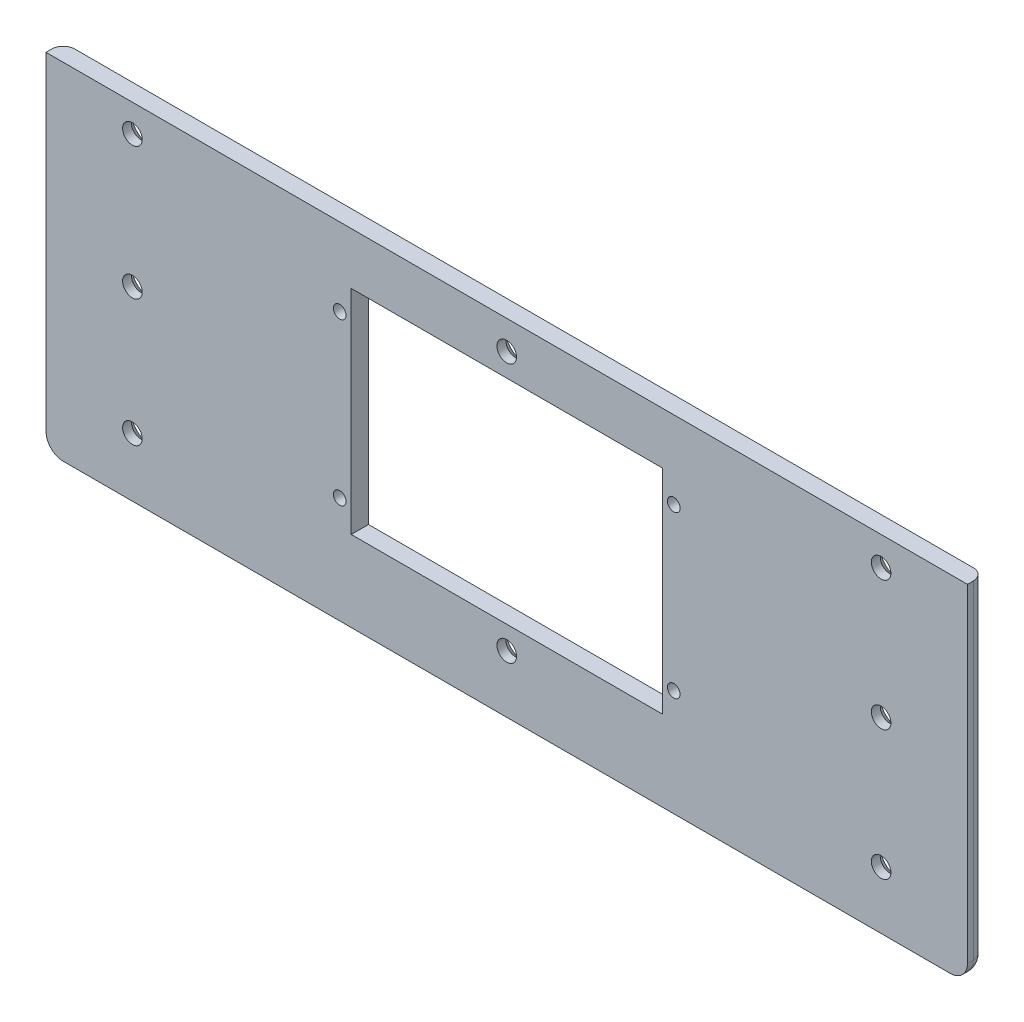
from build123d import *

# Parameters (mm, degrees)
SKETCH1_W                                      = 160
SKETCH1_H                                      = 60
BOSS_EXTRUDE1_DEPTH                            = 3
SKETCH2_R                                      = 1.1
SKETCH2_W                                      = 54
SKETCH2_H                                      = 37
CUT_EXTRUDE1_DEPTH                             = 171.906407136
FILLET1_R                                      = 2
FILLET2_R                                      = 3
CSK_FOR_M3_FLAT_HEAD_MACHINE_SCREW1_AT_2_COUNT = 2
CSK_FOR_M3_FLAT_HEAD_MACHINE_SCREW1_AT_2_PITCH = 22.5
CSK_FOR_M3_FLAT_HEAD_MACHINE_SCREW1_AT_3_COUNT = 2
CSK_FOR_M3_FLAT_HEAD_MACHINE_SCREW1_AT_3_PITCH = 45
CSK_FOR_M3_FLAT_HEAD_MACHINE_SCREW1_AT_4_COUNT = 2
CSK_FOR_M3_FLAT_HEAD_MACHINE_SCREW1_AT_4_PITCH = 79.056941504
CSK_FOR_M3_FLAT_HEAD_MACHINE_SCREW1_AT_5_COUNT = 2
CSK_FOR_M3_FLAT_HEAD_MACHINE_SCREW1_AT_5_PITCH = 65
CSK_FOR_M3_FLAT_HEAD_MACHINE_SCREW1_AT_6_COUNT = 2
CSK_FOR_M3_FLAT_HEAD_MACHINE_SCREW1_AT_6_PITCH = 130.000201211
CSK_FOR_M3_FLAT_HEAD_MACHINE_SCREW1_AT_7_COUNT = 2
CSK_FOR_M3_FLAT_HEAD_MACHINE_SCREW1_AT_7_PITCH = 131.97194743
CSK_FOR_M3_FLAT_HEAD_MACHINE_SCREW1_AT_8_COUNT = 2
CSK_FOR_M3_FLAT_HEAD_MACHINE_SCREW1_AT_8_PITCH = 137.493516675


with BuildPart() as part:
    # Sketch1 → Boss-Extrude1 (new body)
    with BuildSketch(Plane.XY):
        with Locations((80, 30)):
            Rectangle(SKETCH1_W, SKETCH1_H)
    extrude(amount=BOSS_EXTRUDE1_DEPTH)

    # Sketch2 → Cut-Extrude1 (cut, through all)
    with BuildSketch(Plane(origin=(0, 0, 0), x_dir=(-1, 0, 0), z_dir=(0, 0, -1))):
        with Locations((-109, 46.5)):
            Circle(SKETCH2_R)
        with Locations((-109, 18.5)):
            Circle(SKETCH2_R)
        with Locations((-51, 18.5)):
            Circle(SKETCH2_R)
        with Locations((-51, 46.5)):
            Circle(SKETCH2_R)
        with Locations((-80, 32.5)):
            Rectangle(SKETCH2_W, SKETCH2_H)
    extrude(amount=-CUT_EXTRUDE1_DEPTH, mode=Mode.SUBTRACT)

    # Fillet1
    fillet1_edges = [part.edges().sort_by_distance(p)[0] for p in [
        (160, 30, 0),
        (80, 0, 0),
        (0, 30, 0),
    ]]
    fillet(fillet1_edges, radius=FILLET1_R)

    # Fillet2
    # the kernel refuses this fillet: 3 mm, written as the material it takes off along each edge
    with BuildSketch(Plane(origin=(3, 3, 0), x_dir=(0, -1, 0), z_dir=(1, 0, 0))) as fillet2_piece_1:
        with BuildLine():
            CenterArc((1, -2), 2, 0, 90)
            Line((3, -2), (3, 0))
            Line((3, 0), (1, 0))
        make_face()
    revolve(axis=Axis((3, 3, 0), (0, 0, -1)), revolution_arc=90, mode=Mode.SUBTRACT)
    with BuildSketch(Plane(origin=(157, 3, 0), x_dir=(1, 0, 0), z_dir=(0, 1, 0))) as fillet2_piece_2:
        with BuildLine():
            CenterArc((1, -2), 2, 0, 90)
            Line((3, -2), (3, 0))
            Line((3, 0), (1, 0))
        make_face()
    revolve(axis=Axis((157, 3, 0), (0, 0, -1)), revolution_arc=90, mode=Mode.SUBTRACT)
    with BuildSketch(Plane(origin=(160, 0, 0), x_dir=(-1, 0, 0), z_dir=(0, 0, 1))) as fillet2_piece_3:
        with BuildLine():
            CenterArc((FILLET2_R, -FILLET2_R), FILLET2_R, 90, 90)
            Line((0, -FILLET2_R), (0, 0))
            Line((0, 0), (FILLET2_R, 0))
        make_face()
    extrude(amount=10.5, mode=Mode.SUBTRACT)
    with BuildSketch(Plane(origin=(0, 0, 0), x_dir=(1, 0, 0), z_dir=(0, 0, 1))) as fillet2_piece_4:
        with BuildLine():
            CenterArc((FILLET2_R, FILLET2_R), FILLET2_R, 180, 90)
            Line((0, FILLET2_R), (0, 0))
            Line((0, 0), (FILLET2_R, 0))
        make_face()
    extrude(amount=10.5, mode=Mode.SUBTRACT)

    # Sketch5 → CSK for M3 Flat Head Machine Screw1 (revolve, cut)
    with BuildSketch(Plane(origin=(145, 55, 0), x_dir=(0, 1, 0), z_dir=(1, 0, 0))):
        Polygon((0, 0), (0, 3), (1.7, 3), (1.7, 1.45), (3.15, 0), align=None)
    csk_for_m3_flat_head_machine_screw1 = revolve(axis=Axis((145, 55, -6.35), (0, 0, 1)), mode=Mode.SUBTRACT)

    # CSK for M3 Flat Head Machine Screw1 at 2: CSK for M3 Flat Head Machine Screw1 ×2
    with Locations(*[(0, -i * CSK_FOR_M3_FLAT_HEAD_MACHINE_SCREW1_AT_2_PITCH, 0) for i in range(1, CSK_FOR_M3_FLAT_HEAD_MACHINE_SCREW1_AT_2_COUNT)]):
        add(csk_for_m3_flat_head_machine_screw1, mode=Mode.SUBTRACT)

    # CSK for M3 Flat Head Machine Screw1 at 3: CSK for M3 Flat Head Machine Screw1 ×2
    with Locations(*[(0, -i * CSK_FOR_M3_FLAT_HEAD_MACHINE_SCREW1_AT_3_PITCH, 0) for i in range(1, CSK_FOR_M3_FLAT_HEAD_MACHINE_SCREW1_AT_3_COUNT)]):
        add(csk_for_m3_flat_head_machine_screw1, mode=Mode.SUBTRACT)

    # CSK for M3 Flat Head Machine Screw1 at 4: CSK for M3 Flat Head Machine Screw1 ×2
    with Locations(*[Vector(-0.8221921916437787, -0.5692099788303083, 0) * (i * CSK_FOR_M3_FLAT_HEAD_MACHINE_SCREW1_AT_4_PITCH) for i in range(1, CSK_FOR_M3_FLAT_HEAD_MACHINE_SCREW1_AT_4_COUNT)]):
        add(csk_for_m3_flat_head_machine_screw1, mode=Mode.SUBTRACT)

    # CSK for M3 Flat Head Machine Screw1 at 5: CSK for M3 Flat Head Machine Screw1 ×2
    with Locations(*[(-i * CSK_FOR_M3_FLAT_HEAD_MACHINE_SCREW1_AT_5_PITCH, 0, 0) for i in range(1, CSK_FOR_M3_FLAT_HEAD_MACHINE_SCREW1_AT_5_COUNT)]):
        add(csk_for_m3_flat_head_machine_screw1, mode=Mode.SUBTRACT)

    # CSK for M3 Flat Head Machine Screw1 at 6: CSK for M3 Flat Head Machine Screw1 ×2
    with Locations(*[Vector(-0.9999984522282437, 0.0017594149928170457, 0) * (i * CSK_FOR_M3_FLAT_HEAD_MACHINE_SCREW1_AT_6_PITCH) for i in range(1, CSK_FOR_M3_FLAT_HEAD_MACHINE_SCREW1_AT_6_COUNT)]):
        add(csk_for_m3_flat_head_machine_screw1, mode=Mode.SUBTRACT)

    # CSK for M3 Flat Head Machine Screw1 at 7: CSK for M3 Flat Head Machine Screw1 ×2
    with Locations(*[Vector(-0.9850578288164882, -0.17222390625968964, 0) * (i * CSK_FOR_M3_FLAT_HEAD_MACHINE_SCREW1_AT_7_PITCH) for i in range(1, CSK_FOR_M3_FLAT_HEAD_MACHINE_SCREW1_AT_7_COUNT)]):
        add(csk_for_m3_flat_head_machine_screw1, mode=Mode.SUBTRACT)

    # CSK for M3 Flat Head Machine Screw1 at 8: CSK for M3 Flat Head Machine Screw1 ×2
    with Locations(*[Vector(-0.9454991271168818, -0.3256246314719061, 0) * (i * CSK_FOR_M3_FLAT_HEAD_MACHINE_SCREW1_AT_8_PITCH) for i in range(1, CSK_FOR_M3_FLAT_HEAD_MACHINE_SCREW1_AT_8_COUNT)]):
        add(csk_for_m3_flat_head_machine_screw1, mode=Mode.SUBTRACT)


solid = part.part
